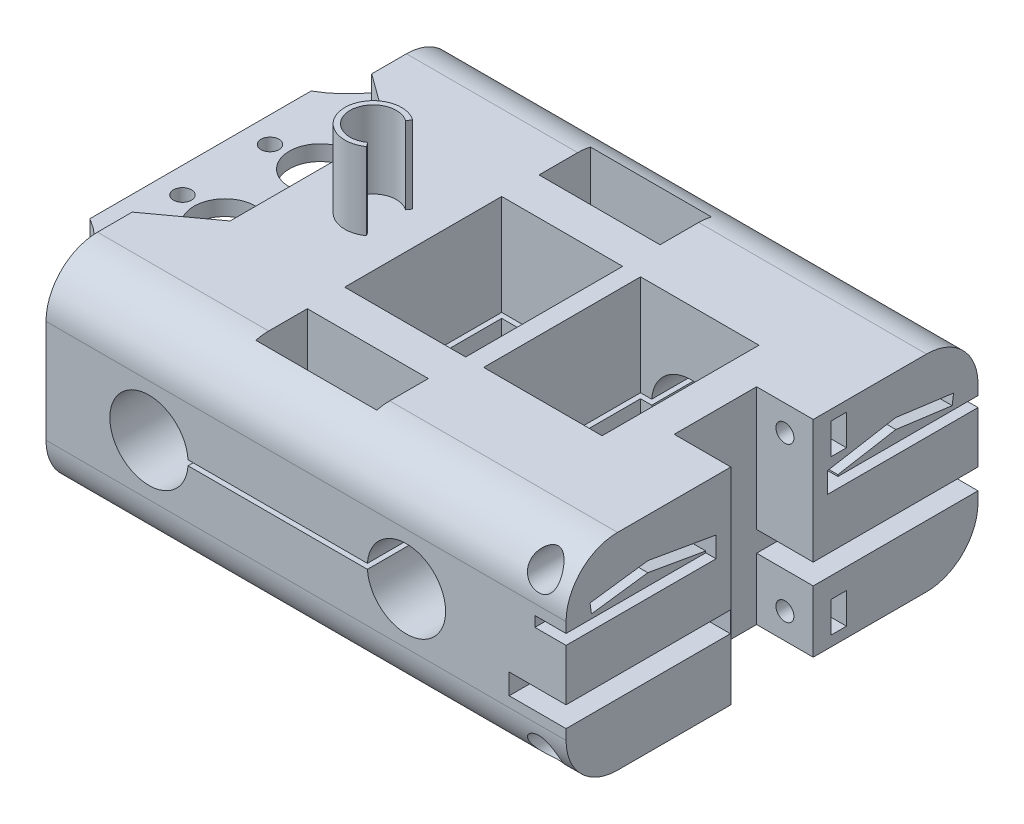
from build123d import *

# Parameters (mm, degrees)
SKETCH1_W                    = 90
SKETCH1_H                    = 40
SKETCH1_R                    = 7.6
BOSS_EXTRUDE1_DEPTH          = 80
SKETCH2_W                    = 30.5
SKETCH2_H                    = 40
CUT_EXTRUDE1_DEPTH           = 10
SKETCH3_W                    = 23.5
SKETCH3_H                    = 30.5
SKETCH3_H_2                  = 10
CUT_EXTRUDE2_DEPTH           = 46
CHAMFER1_SIZE                = 10
SKETCH4_W                    = 30.5
SKETCH4_H                    = 3
BOSS_EXTRUDE2_DEPTH          = 20
SKETCH5_R                    = 1.75
CUT_EXTRUDE3_DEPTH           = 20
SKETCH6_R                    = 6
CUT_EXTRUDE4_DEPTH           = 20
SKETCH8_W                    = 30.5
SKETCH8_H                    = 7
CUT_EXTRUDE5_DEPTH           = 1
CHAMFER3_SIZE                = 8
CHAMFER3_SIZE_2              = 11
CHAMFER4_SIZE                = 8
CHAMFER4_SIZE_2              = 45.370254557
SKETCH9_R                    = 1.75
CUT_EXTRUDE6_DEPTH           = 33
CUT_EXTRUDE7_DEPTH           = 13.25
EXTRUDE_THIN1_DEPTH          = 15
FILLET1_R                    = 10
CUT_EXTRUDE_THIN1_DEPTH      = 112.915146428
CUT_EXTRUDE_THIN1_DEPTH_BACK = 95
FILLET2_START                = 10
FILLET2_DEPTH                = 3
BOSS_EXTRUDE3_DEPTH          = 11
CUT_EXTRUDE_THIN2_START      = -6
CUT_EXTRUDE_THIN2_DEPTH      = 148.230308362
CUT_EXTRUDE_THIN3_START      = -11
SKETCH15_W                   = 32
SKETCH15_H                   = 4
CUT_EXTRUDE_THIN3_DEPTH      = 153.230308362
SKETCH16_R                   = 1.75
CUT_EXTRUDE8_DEPTH           = 15.99669
SKETCH17_W                   = 3
SKETCH17_H                   = 6
CUT_EXTRUDE9_DEPTH           = 11
SKETCH18_W                   = 23
SKETCH18_H                   = 30.465957047
CUT_EXTRUDE10_DEPTH          = 72
SKETCH19_R                   = 3
CUT_EXTRUDE11_DEPTH          = 22


with BuildPart() as part:
    # Sketch1 → Boss-Extrude1 (new body)
    with BuildSketch(Plane.XY):
        with Locations((25, 0)):
            Rectangle(SKETCH1_W, SKETCH1_H)
        Circle(SKETCH1_R, mode=Mode.SUBTRACT)
        with Locations((50, 0)):
            Circle(SKETCH1_R, mode=Mode.SUBTRACT)
    extrude(amount=BOSS_EXTRUDE1_DEPTH)

    # Sketch2 → Cut-Extrude1 (cut)
    with BuildSketch(Plane.ZY.offset(20)):
        with Locations((40, 0)):
            Rectangle(SKETCH2_W, SKETCH2_H)
    extrude(amount=-CUT_EXTRUDE1_DEPTH, mode=Mode.SUBTRACT)

    # Sketch3 → Cut-Extrude2 (cut)
    with BuildSketch(Plane(origin=(0, 20, 0), x_dir=(1, 0, 0), z_dir=(0, 1, 0))):
        with Locations((25, -40)):
            Rectangle(SKETCH3_W, SKETCH3_H)
        with Locations((25, -12.5)):
            Rectangle(SKETCH3_W, SKETCH3_H_2)
        with Locations((25, -67.5)):
            Rectangle(SKETCH3_W, SKETCH3_H_2)
    extrude(amount=-CUT_EXTRUDE2_DEPTH, mode=Mode.SUBTRACT)

    # Chamfer1
    chamfer1_edges = [part.edges().sort_by_distance(p)[0] for p in [
        (13.25, -20, 67.5),
        (13.25, -20, 12.5),
    ]]
    chamfer(chamfer1_edges, length=CHAMFER1_SIZE)

    # Sketch4 → Boss-Extrude2 (add)
    with BuildSketch(Plane.ZY.offset(10)):
        with Locations((40, 11.5)):
            Rectangle(SKETCH4_W, SKETCH4_H)
    extrude(amount=BOSS_EXTRUDE2_DEPTH)

    # Sketch5 → Cut-Extrude3 (cut)
    with BuildSketch(Plane(origin=(0, 13, 0), x_dir=(1, 0, 0), z_dir=(0, 1, 0))):
        with Locations(Location((-25, -31.5, 0), (0, 0, 180))):
            Circle(SKETCH5_R)
        with Locations(Location((-25, -48.5, 0), (0, 0, 180))):
            Circle(SKETCH5_R)
    extrude(amount=-CUT_EXTRUDE3_DEPTH, mode=Mode.SUBTRACT)

    # Sketch6 → Cut-Extrude4 (cut)
    with BuildSketch(Plane(origin=(0, 13, 0), x_dir=(1, 0, 0), z_dir=(0, 1, 0))):
        with Locations(Location((-16, -30.75, 0), (0, 0, 90))):
            Circle(SKETCH6_R)
        with Locations(Location((-16, -49.25, 0), (0, 0, 270))):
            Circle(SKETCH6_R)
    extrude(amount=-CUT_EXTRUDE4_DEPTH, mode=Mode.SUBTRACT)

    # Sketch8 → Cut-Extrude5 (cut)
    with BuildSketch(Plane.ZY.offset(10)):
        with Locations((40, 16.5)):
            Rectangle(SKETCH8_W, SKETCH8_H)
    extrude(amount=-CUT_EXTRUDE5_DEPTH, mode=Mode.SUBTRACT)

    # Chamfer3
    # the kernel refuses this chamfer: 11, 8 mm, written as the material it takes off along each edge
    with BuildSketch(Plane(origin=(-20, 48.396981056, 55.25), x_dir=(0, 0, 1), z_dir=(0, -1, 0))) as chamfer3_piece_1:
        Polygon((CHAMFER3_SIZE, 0), (0, -CHAMFER3_SIZE_2), (0, 0), align=None)
    extrude(amount=35.396981056, mode=Mode.SUBTRACT)
    with BuildSketch(Plane(origin=(-20, 13, 24.75), x_dir=(1, 0, 0), z_dir=(0, 1, 0))) as chamfer3_piece_2:
        Polygon((CHAMFER3_SIZE_2, 0), (0, CHAMFER3_SIZE), (0, 0), align=None)
    extrude(amount=35.396981056, mode=Mode.SUBTRACT)

    # Chamfer4
    # the kernel refuses this chamfer: 45.370254557, 8 mm, written as the material it adds along each edge
    with BuildSketch(Plane(origin=(-20, 13, 55.25), x_dir=(0, 0, 1), z_dir=(0, -1, 0))) as chamfer4_piece_1_section:
        Polygon((CHAMFER4_SIZE, 0), (0, CHAMFER4_SIZE_2), (0, 0), align=None)
    chamfer4_piece_1 = extrude(amount=3, mode=Mode.PRIVATE)
    chamfer4_piece_1 = split(chamfer4_piece_1, bisect_by=Plane(origin=(-30, 13, 55.25), z_dir=(1, 0, 0)), keep=Keep.TOP, mode=Mode.PRIVATE)
    add(chamfer4_piece_1)
    # the kernel refuses this chamfer: 45.370254557, 8 mm, written as the material it adds along each edge
    with BuildSketch(Plane(origin=(-20, 10, 24.75), x_dir=(0, 0, -1), z_dir=(0, 1, 0))) as chamfer4_2_piece_1_section:
        Polygon((CHAMFER4_SIZE, 0), (0, CHAMFER4_SIZE_2), (0, 0), align=None)
    chamfer4_2_piece_1 = extrude(amount=3, mode=Mode.PRIVATE)
    chamfer4_2_piece_1 = split(chamfer4_2_piece_1, bisect_by=Plane(origin=(-30, 10, 24.75), z_dir=(1, 0, 0)), keep=Keep.TOP, mode=Mode.PRIVATE)
    add(chamfer4_2_piece_1)

    # Sketch9 → Cut-Extrude6 (cut)
    with BuildSketch(Plane.ZY.offset(10)):
        with Locations(Location((40, -10, 0), (0, 0, 270))):
            Circle(SKETCH9_R)
    extrude(amount=-CUT_EXTRUDE6_DEPTH, mode=Mode.SUBTRACT)

    # Sketch10 → Cut-Extrude7 (cut)
    with BuildSketch(Plane(origin=(13.25, 0, 0), x_dir=(0, 0, -1), z_dir=(1, 0, 0))):
        Polygon((-40, -13.464101615), (-37, -11.732050808), (-37, -8.267949192), (-40, -6.535898385), (-43, -8.267949192), (-43, -11.732050808), align=None)
    extrude(amount=-CUT_EXTRUDE7_DEPTH, mode=Mode.SUBTRACT)

    # Sketch11 → Extrude-Thin1 (add)
    with BuildSketch(Plane(origin=(0, 20, 0), x_dir=(1, 0, 0), z_dir=(0, 1, 0))):
        with BuildLine():
            ThreePointArc((6.729729503, -35.51864706), (-1.958918458, -40), (6.729729503, -44.48135294))
            Line((6.729729503, -44.48135294), (6.149975329, -43.666561497))
            ThreePointArc((6.149975329, -43.666561497), (-0.958918458, -40), (6.149975329, -36.333438503))
            Line((6.149975329, -36.333438503), (6.729729503, -35.51864706))
        make_face()
    extrude(amount=EXTRUDE_THIN1_DEPTH)

    # Fillet1
    # the kernel refuses this fillet: 10 mm, written as the material it takes off along each edge
    with BuildSketch(Plane(origin=(-45, 20, 80), x_dir=(0, 0, -1), z_dir=(1, 0, 0)), Plane(origin=(95, -20, 80), x_dir=(0, 0, -1), z_dir=(-1, 0, 0)), Plane(origin=(95, -20, 0), x_dir=(0, 1, 0), z_dir=(-1, 0, 0)), Plane(origin=(-45, 20, 0), x_dir=(0, -1, 0), z_dir=(1, 0, 0))) as fillet1_piece_1:
        with BuildLine():
            CenterArc((FILLET1_R, -FILLET1_R), FILLET1_R, 90, 90)
            Line((0, -FILLET1_R), (0, 0))
            Line((0, 0), (FILLET1_R, 0))
        make_face()
    extrude(amount=140, mode=Mode.SUBTRACT)

    # Sketch12 → Cut-Extrude-Thin1 (cut, two sides: drawn at the far end of the back side and taken through both)
    with BuildSketch(Plane.XY.offset(80).offset(-CUT_EXTRUDE_THIN1_DEPTH_BACK)):
        Polygon((3.119310539, -0.5), (7.6, -0.5), (42.4, -0.5), (46.98201893, -0.5), (46.98201893, 0.5), (42.4, 0.5), (7.6, 0.5), (3.119310539, 0.5), align=None)
    extrude(amount=CUT_EXTRUDE_THIN1_DEPTH + CUT_EXTRUDE_THIN1_DEPTH_BACK, mode=Mode.SUBTRACT)

    # Fillet2: read off the stored shape, not the designer's step
    # Fillet2 outline → Fillet2 (add)
    with BuildSketch(Plane(origin=(0, 0, 0), x_dir=(1, 0, 0), z_dir=(0, 1, 0)).offset(FILLET2_START)):
        with BuildLine():
            ThreePointArc((-30, -61.486730193), (-22.679491924, -68.807238269), (-20, -78.807238269))
            Line((-20, -78.807238269), (-20, -63.25))
            Line((-20, -63.25), (-30, -61.486730193))
        make_face()
        with BuildLine():
            Line((-20, -16.75), (-20, -1.192761731))
            ThreePointArc((-20, -1.192761731), (-22.679491924, -11.192761731), (-30, -18.513269807))
            Line((-30, -18.513269807), (-20, -16.75))
        make_face()
    extrude(amount=FILLET2_DEPTH)

    # Sketch13 → Boss-Extrude3 (add)
    with BuildSketch(Plane(origin=(70, 0, 0), x_dir=(0, 0, -1), z_dir=(1, 0, 0))):
        with BuildLine():
            Line((-10, 20), (-32, 20))
            Line((-32, 20), (-32, -20))
            Line((-32, -20), (-10, -20))
            ThreePointArc((-10, -20), (-2.928932188, -17.071067812), (0, -10))
            Line((0, -10), (0, 10))
            ThreePointArc((0, 10), (-2.928932188, 17.071067812), (-10, 20))
        make_face()
        with BuildLine():
            Line((-48, -20), (-48, 20))
            Line((-48, 20), (-70, 20))
            ThreePointArc((-70, 20), (-77.071067812, 17.071067812), (-80, 10))
            Line((-80, 10), (-80, -10))
            ThreePointArc((-80, -10), (-77.071067812, -17.071067812), (-70, -20))
            Line((-70, -20), (-48, -20))
        make_face()
    extrude(amount=BOSS_EXTRUDE3_DEPTH)

    # Sketch14 → Cut-Extrude-Thin2 (cut)
    with BuildSketch(Plane(origin=(81, 0, 0), x_dir=(0, 0, -1), z_dir=(1, 0, 0)).offset(CUT_EXTRUDE_THIN2_START)):
        Polygon((0, 6), (-29.211170014, 6), (-29.211170014, 10), (-16.003311772, 12.306433224), (-4.745103337, 10.807010671), (-5.009141506, 8.824516321), (-15.962361409, 10.283319029), (-27.211170014, 8.318986477), (-27.211170014, 8), (0, 8), align=None)
    cut_extrude_thin2 = extrude(amount=CUT_EXTRUDE_THIN2_DEPTH, mode=Mode.SUBTRACT)

    # Sketch15 → Cut-Extrude-Thin3 (cut)
    with BuildSketch(Plane(origin=(81, 0, 0), x_dir=(0, 0, -1), z_dir=(1, 0, 0)).offset(CUT_EXTRUDE_THIN3_START)):
        with Locations((-16, -6)):
            Rectangle(SKETCH15_W, SKETCH15_H)
    cut_extrude_thin3 = extrude(amount=CUT_EXTRUDE_THIN3_DEPTH, mode=Mode.SUBTRACT)

    # Sketch16 → Cut-Extrude8 (cut)
    with BuildSketch(Plane.XY.offset(32)):
        with Locations((75.5, 15)):
            Circle(SKETCH16_R)
        with Locations((75.5, -15)):
            Circle(SKETCH16_R)
    cut_extrude8 = extrude(amount=-CUT_EXTRUDE8_DEPTH, mode=Mode.SUBTRACT)

    # Sketch17 → Cut-Extrude9 (cut)
    with BuildSketch(Plane(origin=(81, 0, 0), x_dir=(0, 0, -1), z_dir=(1, 0, 0))):
        with Locations((-27.043626223, 15)):
            Rectangle(SKETCH17_W, SKETCH17_H)
    cut_extrude9 = extrude(amount=-CUT_EXTRUDE9_DEPTH, mode=Mode.SUBTRACT)

    # Mirror1: Cut-Extrude9 across plane
    add(cut_extrude9.mirror(Plane.ZX), mode=Mode.SUBTRACT)

    # Sketch18 → Cut-Extrude10 (cut)
    with BuildSketch(Plane(origin=(0, 20, 0), x_dir=(1, 0, 0), z_dir=(0, 1, 0))):
        with Locations((51.74672632, -40.017021476)):
            Rectangle(SKETCH18_W, SKETCH18_H)
    extrude(amount=-CUT_EXTRUDE10_DEPTH, mode=Mode.SUBTRACT)

    # Mirror4: Cut-Extrude-Thin2, Cut-Extrude-Thin3 across plane
    add(cut_extrude_thin2.mirror(Plane(origin=(-0.025214783, 0, 39.991629957), x_dir=(0.9999998012339909, 0, 0.0006305013708499051), z_dir=(0.0006305013708499051, 0, -0.999999801233991))), mode=Mode.SUBTRACT)
    add(cut_extrude_thin3.mirror(Plane(origin=(-0.025214783, 0, 39.991629957), x_dir=(0.9999998012339909, 0, 0.0006305013708499051), z_dir=(0.0006305013708499051, 0, -0.999999801233991))), mode=Mode.SUBTRACT)

    # Mirror5: Cut-Extrude8 across plane
    add(cut_extrude8.mirror(Plane(origin=(-0.025214783, 0, 39.991629957), x_dir=(0.9999998012339909, 0, 0.0006305013708499051), z_dir=(0.0006305013708499051, 0, -0.999999801233991))), mode=Mode.SUBTRACT)

    # Sketch19 → Cut-Extrude11 (cut)
    with BuildSketch(Plane.XY.offset(80)):
        with Locations((75.5, 15)):
            Circle(SKETCH19_R)
        with Locations((75.5, -15)):
            Circle(SKETCH19_R)
    extrude(amount=-CUT_EXTRUDE11_DEPTH, mode=Mode.SUBTRACT)


solid = part.part
